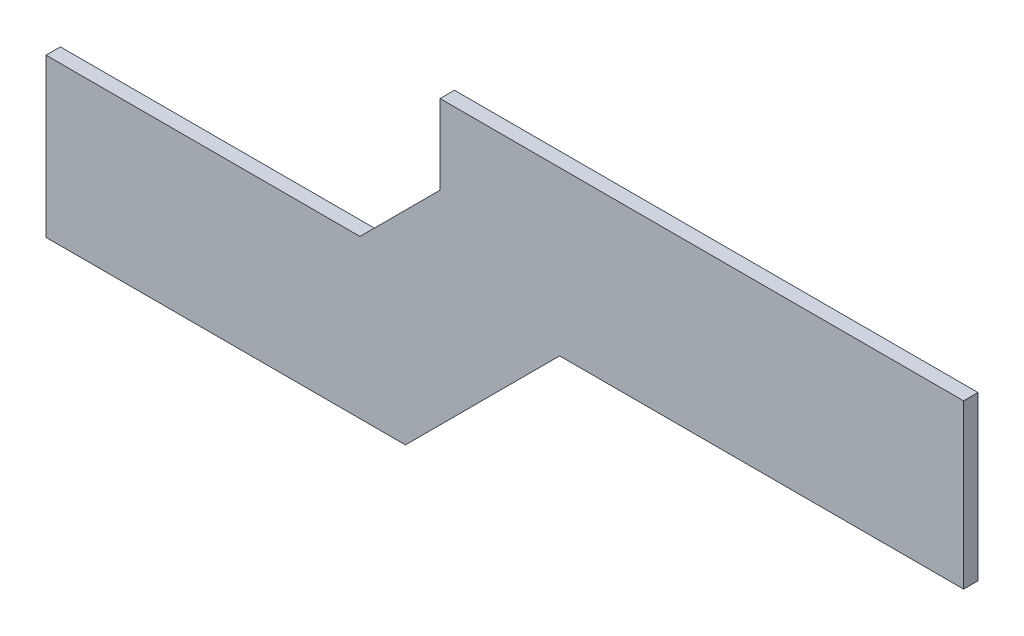
from build123d import *

# Parameters (mm, degrees)
EXTRUDE_1_DEPTH = 4


with BuildPart() as part:
    # Эскиз1 → Бобышка-Вытянуть1 (new body)
    with BuildSketch(Plane.XY):
        Polygon((-164.468308742, 1.015256317), (-164.468308742, -42.878649227), (-64.510812478, -42.878649227), (-21.632163251, 0), (90.710530021, 0), (90.710530021, 45.353810043), (-54.886052795, 45.353810043), (-54.886052795, 23.298924803), (-77.169721281, 1.015256317), align=None)
    extrude(amount=EXTRUDE_1_DEPTH)


solid = part.part
